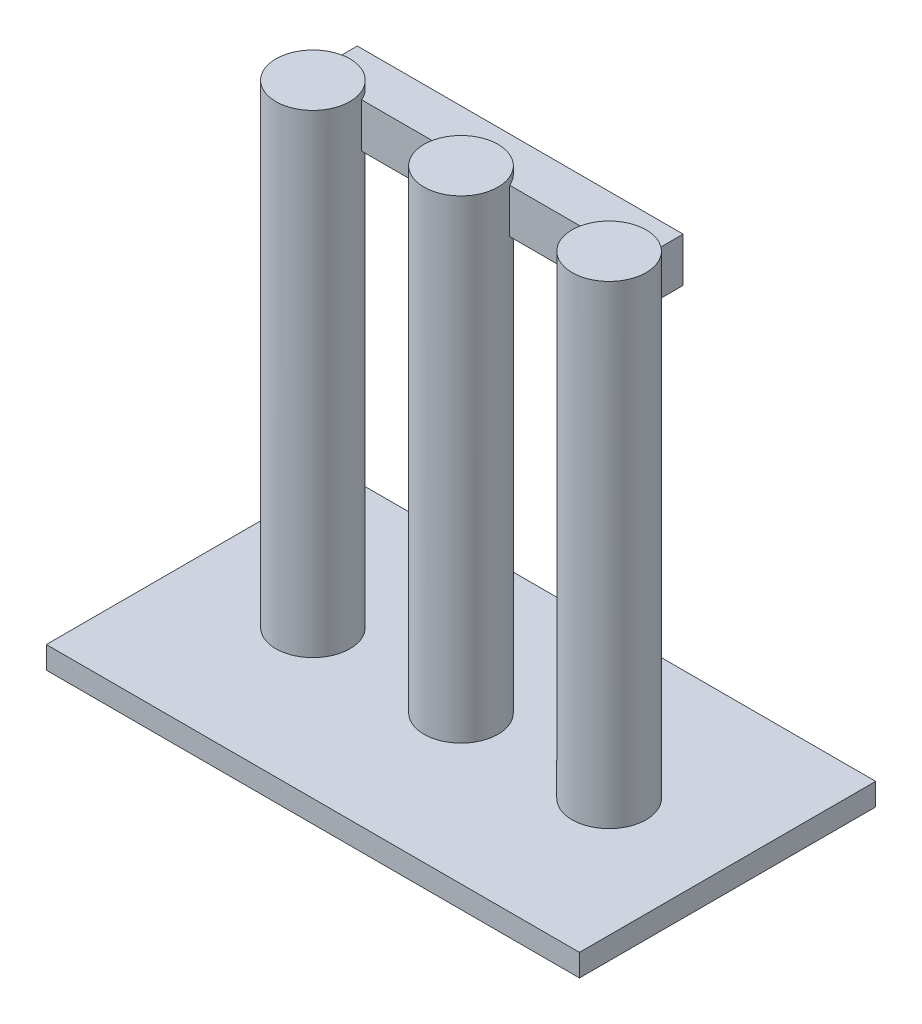
from build123d import *

# Parameters (mm, degrees)
SKETCH1_W           = 3600
SKETCH1_H           = 2000
BOSS_EXTRUDE1_DEPTH = 150
BOSS_EXTRUDE2_START = 150
SKETCH2_R           = 250
BOSS_EXTRUDE2_DEPTH = 3200
BOSS_EXTRUDE3_START = 150
SKETCH3_R           = 250
BOSS_EXTRUDE3_DEPTH = 3200
BOSS_EXTRUDE4_START = 150
SKETCH4_R           = 250
BOSS_EXTRUDE4_DEPTH = 3200
BOSS_EXTRUDE5_START = 3000
SKETCH5_W           = 2200
SKETCH5_H           = 300
BOSS_EXTRUDE5_DEPTH = 300


with BuildPart() as part:
    # Sketch1 → Boss-Extrude1 (new body)
    with BuildSketch(Plane(origin=(0, 0, 0), x_dir=(1, 0, 0), z_dir=(0, 1, 0))):
        with Locations((-5500, 4000)):
            Rectangle(SKETCH1_W, SKETCH1_H)
    extrude(amount=BOSS_EXTRUDE1_DEPTH)

    # Sketch2 → Boss-Extrude2 (add)
    with BuildSketch(Plane(origin=(0, 0, 0), x_dir=(1, 0, 0), z_dir=(0, 1, 0)).offset(BOSS_EXTRUDE2_START)):
        with Locations((-6500, 4000)):
            Circle(SKETCH2_R)
    extrude(amount=BOSS_EXTRUDE2_DEPTH)

    # Sketch3 → Boss-Extrude3 (add)
    with BuildSketch(Plane(origin=(0, 0, 0), x_dir=(1, 0, 0), z_dir=(0, 1, 0)).offset(BOSS_EXTRUDE3_START)):
        with Locations((-5500, 4000)):
            Circle(SKETCH3_R)
    extrude(amount=BOSS_EXTRUDE3_DEPTH)

    # Sketch4 → Boss-Extrude4 (add)
    with BuildSketch(Plane(origin=(0, 0, 0), x_dir=(1, 0, 0), z_dir=(0, 1, 0)).offset(BOSS_EXTRUDE4_START)):
        with Locations((-4500, 4000)):
            Circle(SKETCH4_R)
    extrude(amount=BOSS_EXTRUDE4_DEPTH)

    # Sketch5 → Boss-Extrude5 (add)
    with BuildSketch(Plane(origin=(0, 0, 0), x_dir=(1, 0, 0), z_dir=(0, 1, 0)).offset(BOSS_EXTRUDE5_START)):
        with Locations((-5500, 4250)):
            Rectangle(SKETCH5_W, SKETCH5_H)
    extrude(amount=BOSS_EXTRUDE5_DEPTH)


solid = part.part
